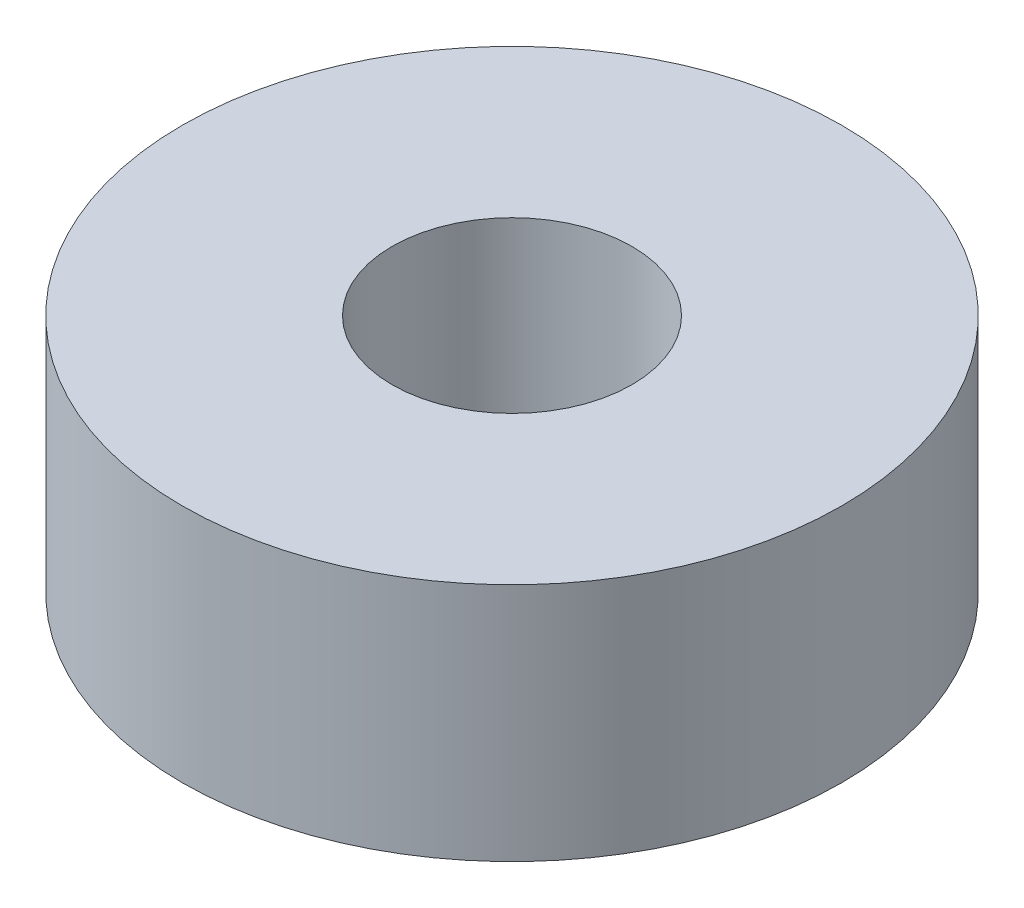
from build123d import *

# Parameters (mm, degrees)
SKETCH_1_R      = 11
SKETCH_1_R_2    = 4
EXTRUDE_1_DEPTH = 8


with BuildPart() as part:
    # 草圖1 → 填料-伸長1 (new body)
    with BuildSketch(Plane(origin=(0, 0, 0), x_dir=(1, 0, 0), z_dir=(0, 1, 0))):
        Circle(SKETCH_1_R)
        Circle(SKETCH_1_R_2, mode=Mode.SUBTRACT)
    extrude(amount=EXTRUDE_1_DEPTH)


solid = part.part
